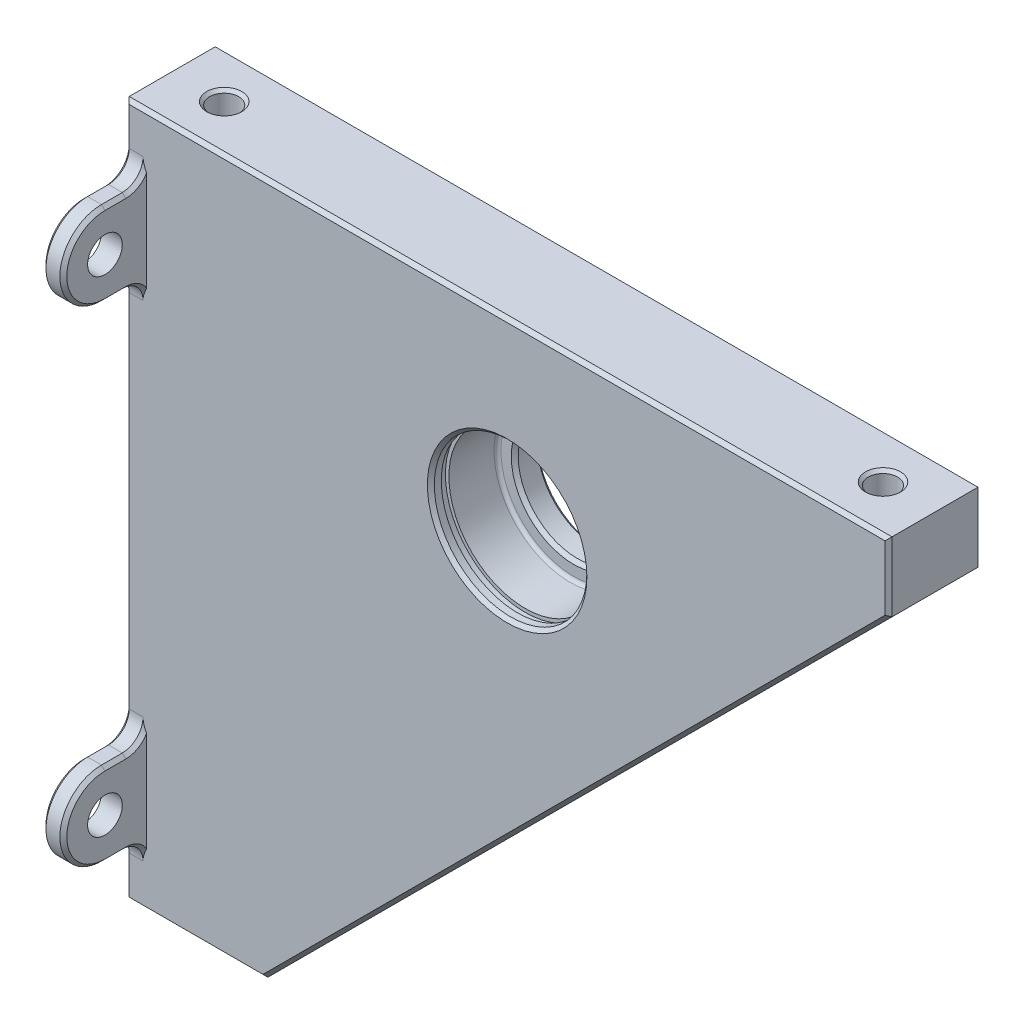
from build123d import *

# Parameters (mm, degrees)
BOSS_EXTRUDE1_DEPTH         = 13.4
BOSS_EXTRUDE2_DEPTH         = 3
FILLET1_R                   = 3
CHAMFER1_SIZE               = 0.5
F_5_0MM_DOWEL_HOLE1_D       = 5
FASE1_SIZE                  = 0.5
M5_TAPPED_HOLE1_D           = 4.2
M5_TAPPED_HOLE1_DEPTH       = 10
M5_TAPPED_HOLE1_CSINK_D     = 5.056
M5_TAPPED_HOLE1_CSINK_ANGLE = 90
M5_TAPPED_HOLE1_TIP         = 1.2618073


with BuildPart() as part:
    # Sketch1 → Boss-Extrude1 (new body)
    with BuildSketch(Plane.XY):
        Polygon((0, 0), (20, 0), (110, 90), (110, 100), (0, 100), align=None)
    extrude(amount=BOSS_EXTRUDE1_DEPTH)

    # Sketch3 → Boss-Extrude2 (add)
    with BuildSketch(Plane.ZY):
        with BuildLine():
            Line((13.4, 91), (19.4, 91))
            ThreePointArc((19.4, 91), (25.4, 85), (19.4, 79))
            Line((19.4, 79), (13.4, 79))
            Line((13.4, 79), (13.4, 91))
        make_face()
        with BuildLine():
            Line((13.4, 21), (19.4, 21))
            ThreePointArc((19.4, 21), (25.4, 15), (19.4, 9))
            Line((19.4, 9), (13.4, 9))
            Line((13.4, 9), (13.4, 21))
        make_face()
        with BuildLine():
            Line((0, 91), (-6, 91))
            ThreePointArc((-6, 91), (-12, 85), (-6, 79))
            Line((-6, 79), (0, 79))
            Line((0, 79), (0, 91))
        make_face()
        with BuildLine():
            Line((0, 21), (-6, 21))
            ThreePointArc((-6, 21), (-12, 15), (-6, 9))
            Line((-6, 9), (0, 9))
            Line((0, 9), (0, 21))
        make_face()
    extrude(amount=-BOSS_EXTRUDE2_DEPTH)

    # Fillet1
    fillet1_edges = [part.edges().sort_by_distance(p)[0] for p in [
        (1.5, 9, 13.4),
        (1.5, 21, 13.4),
        (1.5, 91, 0),
        (1.5, 79, 0),
        (1.5, 21, 0),
        (1.5, 9, 0),
        (1.5, 79, 13.4),
        (1.5, 91, 13.4),
    ]]
    fillet(fillet1_edges, radius=FILLET1_R)

    # Chamfer1
    # the kernel refuses this chamfer: 0.5 mm, written as the material it takes off along each edge
    with BuildSketch(Plane(origin=(19.09077276, -0.90922724, 13.4), x_dir=(0.01944252080601503, -0.019442520806014957, -0.9996219169112968), z_dir=(0.7071067811865462, 0.7071067811865489, 0))) as chamfer1_piece_1:
        Polygon((CHAMFER1_SIZE * 0.999621916911, CHAMFER1_SIZE * 0.0274958766106), (-CHAMFER1_SIZE * 0.0274958766106, CHAMFER1_SIZE * 0.999621916911), (0, 0), align=None)
    extrude(amount=129.850903602, mode=Mode.SUBTRACT)
    with BuildSketch(Plane(origin=(110, 88.714158506, 13.4), x_dir=(0.0274958766105822, 0, -0.999621916911297), z_dir=(0, 1, 0))) as chamfer1_piece_2:
        Polygon((CHAMFER1_SIZE * 0.999621916911, CHAMFER1_SIZE * 0.0274958766106), (-CHAMFER1_SIZE * 0.0274958766106, CHAMFER1_SIZE * 0.999621916911), (0, 0), align=None)
    extrude(amount=12.571682988, mode=Mode.SUBTRACT)
    with BuildSketch(Plane(origin=(111.285841494, 100, 13.4), x_dir=(0, 0.0274958766105822, -0.999621916911297), z_dir=(-1, 0, 0)), Plane(origin=(111.285841494, 100, 0), x_dir=(0, -0.9996219169112968, -0.027495876610586483), z_dir=(-1, 0, 0))) as chamfer1_piece_3:
        Polygon((CHAMFER1_SIZE * 0.999621916911, CHAMFER1_SIZE * 0.0274958766106), (-CHAMFER1_SIZE * 0.0274958766106, CHAMFER1_SIZE * 0.999621916911), (0, 0), align=None)
    extrude(amount=112.571682988, mode=Mode.SUBTRACT)
    with BuildSketch(Plane(origin=(3, 21, 16.4), x_dir=(0.02749587661058555, -0.9996219169112968, 1.1837901526131803e-15), z_dir=(0, 0, 1)), Plane(origin=(0, 79, -6), x_dir=(-0.027495876610586535, 0.9996219169112968, 0), z_dir=(0, 0, 1)), Plane(origin=(0, 9, -6), x_dir=(-0.027495876610586584, 0.9996219169112968, 0), z_dir=(0, 0, 1)), Plane(origin=(3, 91, 16.4), x_dir=(0.02749587661058574, -0.9996219169112968, 2.3675803052263605e-15), z_dir=(0, 0, 1)), Plane(origin=(3, 79, 19.4), x_dir=(0.027495876610586605, 0.9996219169112968, -2.3675803052263605e-15), z_dir=(0, 0, -1)), Plane(origin=(3, 9, 19.4), x_dir=(0.02749587661058651, 0.9996219169112968, -1.1837901526131803e-15), z_dir=(0, 0, -1)), Plane(origin=(0, 21, -3), x_dir=(-0.027495876610586823, -0.9996219169112968, 0), z_dir=(0, 0, -1)), Plane(origin=(0, 91, -3), x_dir=(-0.027495876610586435, -0.9996219169112968, 0), z_dir=(0, 0, -1))) as chamfer1_piece_4:
        Polygon((CHAMFER1_SIZE * 0.999621916911, -CHAMFER1_SIZE * 0.0274958766106), (-CHAMFER1_SIZE * 0.0274958766106, -CHAMFER1_SIZE * 0.999621916911), (0, 0), align=None)
    extrude(amount=3, mode=Mode.SUBTRACT)
    with BuildSketch(Plane(origin=(3, 15, 19.4), x_dir=(0, 1, 0), z_dir=(0, 0, -1))) as chamfer1_piece_5:
        Polygon((6 - CHAMFER1_SIZE, 0), (6, -CHAMFER1_SIZE), (6, 0), align=None)
    revolve(axis=Axis((3, 15, 19.4), (1, 0, 0)), revolution_arc=180, mode=Mode.SUBTRACT)
    with BuildSketch(Plane(origin=(0, 15, 19.4), x_dir=(0, 1, 0), z_dir=(0, 0, -1))) as chamfer1_piece_6:
        Polygon((6 - CHAMFER1_SIZE, 0), (6, CHAMFER1_SIZE), (6, 0), align=None)
    revolve(axis=Axis((0, 15, 19.4), (1, 0, 0)), revolution_arc=180, mode=Mode.SUBTRACT)
    with BuildSketch(Plane(origin=(0, 21, 16.4), x_dir=(-0.027495876610586823, -0.9996219169112968, 1.1837901526131803e-15), z_dir=(0, 0, 1)), Plane(origin=(3, 79, -6), x_dir=(0.027495876610586605, 0.9996219169112968, 0), z_dir=(0, 0, 1)), Plane(origin=(3, 9, -6), x_dir=(0.02749587661058651, 0.9996219169112968, 0), z_dir=(0, 0, 1)), Plane(origin=(0, 91, 16.4), x_dir=(-0.027495876610586435, -0.9996219169112968, 2.3675803052263605e-15), z_dir=(0, 0, 1)), Plane(origin=(0, 79, 19.4), x_dir=(-0.027495876610586535, 0.9996219169112968, -2.3675803052263605e-15), z_dir=(0, 0, -1)), Plane(origin=(0, 9, 19.4), x_dir=(-0.027495876610586584, 0.9996219169112968, -1.1837901526131803e-15), z_dir=(0, 0, -1)), Plane(origin=(3, 21, -3), x_dir=(0.02749587661058555, -0.9996219169112968, 0), z_dir=(0, 0, -1)), Plane(origin=(3, 91, -3), x_dir=(0.02749587661058574, -0.9996219169112968, 0), z_dir=(0, 0, -1))) as chamfer1_piece_7:
        Polygon((CHAMFER1_SIZE * 0.999621916911, CHAMFER1_SIZE * 0.0274958766106), (-CHAMFER1_SIZE * 0.0274958766106, CHAMFER1_SIZE * 0.999621916911), (0, 0), align=None)
    extrude(amount=3, mode=Mode.SUBTRACT)
    with BuildSketch(Plane(origin=(3, 85, -6), x_dir=(0, 1, 0), z_dir=(0, 0, 1))) as chamfer1_piece_8:
        Polygon((6 - CHAMFER1_SIZE, 0), (6, CHAMFER1_SIZE), (6, 0), align=None)
    revolve(axis=Axis((3, 85, -6), (-1, 0, 0)), revolution_arc=180, mode=Mode.SUBTRACT)
    with BuildSketch(Plane(origin=(0, 85, -6), x_dir=(0, 1, 0), z_dir=(0, 0, 1))) as chamfer1_piece_9:
        Polygon((6 - CHAMFER1_SIZE, 0), (6, -CHAMFER1_SIZE), (6, 0), align=None)
    revolve(axis=Axis((0, 85, -6), (-1, 0, 0)), revolution_arc=180, mode=Mode.SUBTRACT)
    with BuildSketch(Plane(origin=(3, 15, -6), x_dir=(0, 1, 0), z_dir=(0, 0, 1))) as chamfer1_piece_10:
        Polygon((6 - CHAMFER1_SIZE, 0), (6, CHAMFER1_SIZE), (6, 0), align=None)
    revolve(axis=Axis((3, 15, -6), (-1, 0, 0)), revolution_arc=180, mode=Mode.SUBTRACT)
    with BuildSketch(Plane(origin=(0, 15, -6), x_dir=(0, 1, 0), z_dir=(0, 0, 1))) as chamfer1_piece_11:
        Polygon((6 - CHAMFER1_SIZE, 0), (6, -CHAMFER1_SIZE), (6, 0), align=None)
    revolve(axis=Axis((0, 15, -6), (-1, 0, 0)), revolution_arc=180, mode=Mode.SUBTRACT)
    with BuildSketch(Plane(origin=(3, 85, 19.4), x_dir=(0, 1, 0), z_dir=(0, 0, -1))) as chamfer1_piece_12:
        Polygon((6 - CHAMFER1_SIZE, 0), (6, -CHAMFER1_SIZE), (6, 0), align=None)
    revolve(axis=Axis((3, 85, 19.4), (1, 0, 0)), revolution_arc=180, mode=Mode.SUBTRACT)
    with BuildSketch(Plane(origin=(0, 85, 19.4), x_dir=(0, 1, 0), z_dir=(0, 0, -1))) as chamfer1_piece_13:
        Polygon((6 - CHAMFER1_SIZE, 0), (6, CHAMFER1_SIZE), (6, 0), align=None)
    revolve(axis=Axis((0, 85, 19.4), (1, 0, 0)), revolution_arc=180, mode=Mode.SUBTRACT)
    with BuildSketch(Plane(origin=(0, 101.285841494, 13.4), x_dir=(-0.027495876610586337, 0, -0.9996219169112968), z_dir=(0, -1, 0)), Plane(origin=(0, 6, 13.4), x_dir=(-0.0274958766105864, 0, -0.9996219169112968), z_dir=(0, -1, 0))) as chamfer1_piece_14:
        Polygon((CHAMFER1_SIZE * 0.999621916911, CHAMFER1_SIZE * 0.0274958766106), (-CHAMFER1_SIZE * 0.0274958766106, CHAMFER1_SIZE * 0.999621916911), (0, 0), align=None)
    extrude(amount=7.285841494, mode=Mode.SUBTRACT)
    with BuildSketch(Plane(origin=(110, 88.714158506, 0), x_dir=(0.02749587661058218, 0, 0.9996219169112968), z_dir=(0, 1, 0))) as chamfer1_piece_15:
        Polygon((CHAMFER1_SIZE * 0.999621916911, -CHAMFER1_SIZE * 0.0274958766106), (-CHAMFER1_SIZE * 0.0274958766106, -CHAMFER1_SIZE * 0.999621916911), (0, 0), align=None)
    extrude(amount=12.571682988, mode=Mode.SUBTRACT)
    with BuildSketch(Plane(origin=(19.09077276, -0.90922724, 0), x_dir=(0.01944252080601502, -0.019442520806014944, 0.9996219169112968), z_dir=(0.7071067811865462, 0.7071067811865489, 0))) as chamfer1_piece_16:
        Polygon((CHAMFER1_SIZE * 0.999621916911, -CHAMFER1_SIZE * 0.0274958766106), (-CHAMFER1_SIZE * 0.0274958766106, -CHAMFER1_SIZE * 0.999621916911), (0, 0), align=None)
    extrude(amount=129.850903602, mode=Mode.SUBTRACT)
    with BuildSketch(Plane(origin=(0, 76, 13.4), x_dir=(-0.027495876610586296, 0, -0.9996219169112968), z_dir=(0, -1, 0))) as chamfer1_piece_17:
        Polygon((CHAMFER1_SIZE * 0.999621916911, CHAMFER1_SIZE * 0.0274958766106), (-CHAMFER1_SIZE * 0.0274958766106, CHAMFER1_SIZE * 0.999621916911), (0, 0), align=None)
    extrude(amount=52, mode=Mode.SUBTRACT)
    with BuildSketch(Plane(origin=(-1.285841494, 0, 0), x_dir=(0, -0.027495876610586372, 0.9996219169112968), z_dir=(1, 0, 0))) as chamfer1_piece_18:
        Polygon((CHAMFER1_SIZE * 0.999621916911, -CHAMFER1_SIZE * 0.0274958766106), (-CHAMFER1_SIZE * 0.0274958766106, -CHAMFER1_SIZE * 0.999621916911), (0, 0), align=None)
    extrude(amount=22.571682988, mode=Mode.SUBTRACT)
    with BuildSketch(Plane(origin=(0, 101.285841494, 0), x_dir=(-0.027495876610586313, 0, 0.9996219169112968), z_dir=(0, -1, 0)), Plane(origin=(0, 6, 0), x_dir=(-0.027495876610586382, 0, 0.9996219169112968), z_dir=(0, -1, 0))) as chamfer1_piece_19:
        Polygon((CHAMFER1_SIZE * 0.999621916911, -CHAMFER1_SIZE * 0.0274958766106), (-CHAMFER1_SIZE * 0.0274958766106, -CHAMFER1_SIZE * 0.999621916911), (0, 0), align=None)
    extrude(amount=7.285841494, mode=Mode.SUBTRACT)
    with BuildSketch(Plane(origin=(0, 76, 0), x_dir=(-0.027495876610586275, 0, 0.9996219169112968), z_dir=(0, -1, 0))) as chamfer1_piece_20:
        Polygon((CHAMFER1_SIZE * 0.999621916911, -CHAMFER1_SIZE * 0.0274958766106), (-CHAMFER1_SIZE * 0.0274958766106, -CHAMFER1_SIZE * 0.999621916911), (0, 0), align=None)
    extrude(amount=52, mode=Mode.SUBTRACT)
    with BuildSketch(Plane(origin=(0, 76, 16.4), x_dir=(0, 0, -1), z_dir=(0, -1, 0))) as chamfer1_piece_21:
        Polygon((3 + CHAMFER1_SIZE, 0), (3, CHAMFER1_SIZE), (3, 0), align=None)
    revolve(axis=Axis((0, 76, 16.4), (1, 0, 0)), revolution_arc=90, mode=Mode.SUBTRACT)
    with BuildSketch(Plane(origin=(3, 76, 16.4), x_dir=(0, -0.4157670192732941, -0.9094711571482629), z_dir=(0, -0.9094711571482629, 0.4157670192732941))) as chamfer1_piece_22_section:
        Polygon((3, -CHAMFER1_SIZE), (3 + CHAMFER1_SIZE, 0), (3, 0), align=None)
    chamfer1_piece_22 = revolve(axis=Axis((3, 76, 16.4), (1, 0, 0)), revolution_arc=114.56762863, mode=Mode.PRIVATE)
    chamfer1_piece_22 = split(chamfer1_piece_22, bisect_by=Plane(origin=(2.821133153, 78.122730565, 13.4), z_dir=(0, 0, 1)), keep=Keep.TOP, mode=Mode.PRIVATE)
    add(chamfer1_piece_22, mode=Mode.SUBTRACT)
    with BuildSketch(Plane(origin=(0, 94, 16.4), x_dir=(0, 0, -1), z_dir=(0, 1, 0))) as chamfer1_piece_23:
        Polygon((3 + CHAMFER1_SIZE, 0), (3, -CHAMFER1_SIZE), (3, 0), align=None)
    revolve(axis=Axis((0, 94, 16.4), (-1, 0, 0)), revolution_arc=90, mode=Mode.SUBTRACT)
    with BuildSketch(Plane(origin=(3, 94, 16.4), x_dir=(0, 0.4157670192732941, -0.9094711571482629), z_dir=(0, 0.9094711571482629, 0.4157670192732941))) as chamfer1_piece_24_section:
        Polygon((3 + CHAMFER1_SIZE, 0), (3, CHAMFER1_SIZE), (3, 0), align=None)
    chamfer1_piece_24 = revolve(axis=Axis((3, 94, 16.4), (-1, 0, 0)), revolution_arc=114.56762863, mode=Mode.PRIVATE)
    chamfer1_piece_24 = split(chamfer1_piece_24, bisect_by=Plane(origin=(2.821133146, 91.87726966, 13.4), z_dir=(0, 0, 1)), keep=Keep.TOP, mode=Mode.PRIVATE)
    add(chamfer1_piece_24, mode=Mode.SUBTRACT)
    with BuildSketch(Plane(origin=(0, 24, 16.4), x_dir=(0, 0, -1), z_dir=(0, 1, 0))) as chamfer1_piece_25:
        Polygon((3 + CHAMFER1_SIZE, 0), (3, -CHAMFER1_SIZE), (3, 0), align=None)
    revolve(axis=Axis((0, 24, 16.4), (-1, 0, 0)), revolution_arc=90, mode=Mode.SUBTRACT)
    with BuildSketch(Plane(origin=(-1.285841494, 0, 13.4), x_dir=(0, -0.02749587661058639, -0.9996219169112968), z_dir=(1, 0, 0))) as chamfer1_piece_26:
        Polygon((CHAMFER1_SIZE * 0.999621916911, CHAMFER1_SIZE * 0.0274958766106), (-CHAMFER1_SIZE * 0.0274958766106, CHAMFER1_SIZE * 0.999621916911), (0, 0), align=None)
    extrude(amount=22.571682988, mode=Mode.SUBTRACT)
    with BuildSketch(Plane(origin=(3, 24, 16.4), x_dir=(0, 0.4157670192732905, -0.9094711571482645), z_dir=(0, 0.9094711571482645, 0.4157670192732905))) as chamfer1_piece_27_section:
        Polygon((3 + CHAMFER1_SIZE, 0), (3, CHAMFER1_SIZE), (3, 0), align=None)
    chamfer1_piece_27 = revolve(axis=Axis((3, 24, 16.4), (-1, 0, 0)), revolution_arc=114.56762863, mode=Mode.PRIVATE)
    chamfer1_piece_27 = split(chamfer1_piece_27, bisect_by=Plane(origin=(2.821133146, 21.877269654, 13.4), z_dir=(0, 0, 1)), keep=Keep.TOP, mode=Mode.PRIVATE)
    add(chamfer1_piece_27, mode=Mode.SUBTRACT)
    with BuildSketch(Plane(origin=(0, 6, 16.4), x_dir=(0, 0, -1), z_dir=(0, -1, 0))) as chamfer1_piece_28:
        Polygon((3 + CHAMFER1_SIZE, 0), (3, CHAMFER1_SIZE), (3, 0), align=None)
    revolve(axis=Axis((0, 6, 16.4), (1, 0, 0)), revolution_arc=90, mode=Mode.SUBTRACT)
    with BuildSketch(Plane(origin=(3, 6, 16.4), x_dir=(0, -0.4157670192732901, -0.9094711571482649), z_dir=(0, -0.9094711571482649, 0.4157670192732901))) as chamfer1_piece_29_section:
        Polygon((3, -CHAMFER1_SIZE), (3 + CHAMFER1_SIZE, 0), (3, 0), align=None)
    chamfer1_piece_29 = revolve(axis=Axis((3, 6, 16.4), (1, 0, 0)), revolution_arc=114.56762863, mode=Mode.PRIVATE)
    chamfer1_piece_29 = split(chamfer1_piece_29, bisect_by=Plane(origin=(2.821133155, 8.122730647, 13.4), z_dir=(0, 0, 1)), keep=Keep.TOP, mode=Mode.PRIVATE)
    add(chamfer1_piece_29, mode=Mode.SUBTRACT)
    with BuildSketch(Plane(origin=(0, 24, -3), x_dir=(0, 0, 1), z_dir=(0, 1, 0))) as chamfer1_piece_30:
        Polygon((3 + CHAMFER1_SIZE, 0), (3, CHAMFER1_SIZE), (3, 0), align=None)
    revolve(axis=Axis((0, 24, -3), (1, 0, 0)), revolution_arc=90, mode=Mode.SUBTRACT)
    with BuildSketch(Plane(origin=(3, 24, -3), x_dir=(0, 0.4157670192732905, 0.9094711571482645), z_dir=(0, 0.9094711571482645, -0.4157670192732905))) as chamfer1_piece_31_section:
        Polygon((3 + CHAMFER1_SIZE, 0), (3, -CHAMFER1_SIZE), (3, 0), align=None)
    chamfer1_piece_31 = revolve(axis=Axis((3, 24, -3), (1, 0, 0)), revolution_arc=114.56762863, mode=Mode.PRIVATE)
    chamfer1_piece_31 = split(chamfer1_piece_31, bisect_by=Plane(origin=(2.821133159, 21.877269233, 0), z_dir=(0, 0, -1)), keep=Keep.TOP, mode=Mode.PRIVATE)
    add(chamfer1_piece_31, mode=Mode.SUBTRACT)
    with BuildSketch(Plane(origin=(0, 6, -3), x_dir=(0, 0, 1), z_dir=(0, -1, 0))) as chamfer1_piece_32:
        Polygon((3 + CHAMFER1_SIZE, 0), (3, -CHAMFER1_SIZE), (3, 0), align=None)
    revolve(axis=Axis((0, 6, -3), (-1, 0, 0)), revolution_arc=90, mode=Mode.SUBTRACT)
    with BuildSketch(Plane(origin=(3, 6, -3), x_dir=(0, -0.4157670192732901, 0.9094711571482649), z_dir=(0, -0.9094711571482649, -0.4157670192732901))) as chamfer1_piece_33_section:
        Polygon((3, CHAMFER1_SIZE), (3 + CHAMFER1_SIZE, 0), (3, 0), align=None)
    chamfer1_piece_33 = revolve(axis=Axis((3, 6, -3), (-1, 0, 0)), revolution_arc=114.56762863, mode=Mode.PRIVATE)
    chamfer1_piece_33 = split(chamfer1_piece_33, bisect_by=Plane(origin=(2.821133152, 8.122730538, 0), z_dir=(0, 0, -1)), keep=Keep.TOP, mode=Mode.PRIVATE)
    add(chamfer1_piece_33, mode=Mode.SUBTRACT)
    with BuildSketch(Plane(origin=(0, 94, -3), x_dir=(0, 0, 1), z_dir=(0, 1, 0))) as chamfer1_piece_34:
        Polygon((3 + CHAMFER1_SIZE, 0), (3, CHAMFER1_SIZE), (3, 0), align=None)
    revolve(axis=Axis((0, 94, -3), (1, 0, 0)), revolution_arc=90, mode=Mode.SUBTRACT)
    with BuildSketch(Plane(origin=(3, 94, -3), x_dir=(0, 0.4157670192732941, 0.9094711571482629), z_dir=(0, 0.9094711571482629, -0.4157670192732941))) as chamfer1_piece_35_section:
        Polygon((3 + CHAMFER1_SIZE, 0), (3, -CHAMFER1_SIZE), (3, 0), align=None)
    chamfer1_piece_35 = revolve(axis=Axis((3, 94, -3), (1, 0, 0)), revolution_arc=114.56762863, mode=Mode.PRIVATE)
    chamfer1_piece_35 = split(chamfer1_piece_35, bisect_by=Plane(origin=(2.821133153, 91.877269435, 0), z_dir=(0, 0, -1)), keep=Keep.TOP, mode=Mode.PRIVATE)
    add(chamfer1_piece_35, mode=Mode.SUBTRACT)
    with BuildSketch(Plane(origin=(0, 76, -3), x_dir=(0, 0, 1), z_dir=(0, -1, 0))) as chamfer1_piece_36:
        Polygon((3 + CHAMFER1_SIZE, 0), (3, -CHAMFER1_SIZE), (3, 0), align=None)
    revolve(axis=Axis((0, 76, -3), (-1, 0, 0)), revolution_arc=90, mode=Mode.SUBTRACT)
    with BuildSketch(Plane(origin=(3, 76, -3), x_dir=(0, -0.4157670192732941, 0.9094711571482629), z_dir=(0, -0.9094711571482629, -0.4157670192732941))) as chamfer1_piece_37_section:
        Polygon((3, CHAMFER1_SIZE), (3 + CHAMFER1_SIZE, 0), (3, 0), align=None)
    chamfer1_piece_37 = revolve(axis=Axis((3, 76, -3), (-1, 0, 0)), revolution_arc=114.56762863, mode=Mode.PRIVATE)
    chamfer1_piece_37 = split(chamfer1_piece_37, bisect_by=Plane(origin=(2.821133153, 78.122730565, 0), z_dir=(0, 0, -1)), keep=Keep.TOP, mode=Mode.PRIVATE)
    add(chamfer1_piece_37, mode=Mode.SUBTRACT)

    # Ø5.0mm Dowel Hole1 (through all)
    with Locations(Plane(origin=(3, 0, 0), x_dir=(0, 0, -1), z_dir=(1, 0, 0))):
        with Locations((-19.4, 85), (-19.4, 15), (6, 15), (6, 85)):
            Hole(F_5_0MM_DOWEL_HOLE1_D / 2)

    # Sketch7 → Cut-Revolve1 (revolve, cut)
    with BuildSketch(Plane(origin=(55, 0, 0), x_dir=(0, 0, -1), z_dir=(1, 0, 0)), mode=Mode.PRIVATE) as cut_revolve1_sk:
        with BuildLine():
            Line((-13.4, 84.5), (-11.9, 84.5))
            Line((-11.9, 84.5), (-11.9, 85))
            Line((-11.9, 85), (-10.8, 85))
            Line((-10.8, 85), (-10.8, 84.5))
            Line((-10.8, 84.5), (-4.3, 84.5))
            ThreePointArc((-4.3, 84.5), (-3.946446609, 84.353553391), (-3.8, 84))
            Line((-3.8, 84), (-3.8, 82))
            Line((-3.8, 82), (0, 82))
            Line((0, 82), (0, 73.5))
            Line((0, 73.5), (-13.4, 73.5))
            Line((-13.4, 73.5), (-13.4, 84.5))
        make_face()
    revolve(cut_revolve1_sk.sketch.rotate(Axis((55, 73.5, 13.4), (0, 0, -1)), 90), axis=Axis((55, 73.5, 13.4), (0, 0, -1)), mode=Mode.SUBTRACT)

    # Fase1
    fase1_edges = [part.edges().sort_by_distance(p)[0] for p in [
        (44, 73.5, 13.4),
        (46.5, 73.5, 3.8),
        (46.5, 73.5, 0),
    ]]
    chamfer(fase1_edges, length=FASE1_SIZE)

    # M5 Tapped Hole1
    with Locations(Plane(origin=(0, 100, 0), x_dir=(1, 0, 0), z_dir=(0, 1, 0))):
        with Locations((7.5, -6.7), (102.5, -6.7)):
            CounterSinkHole(M5_TAPPED_HOLE1_D / 2, M5_TAPPED_HOLE1_CSINK_D / 2, depth=M5_TAPPED_HOLE1_DEPTH, counter_sink_angle=M5_TAPPED_HOLE1_CSINK_ANGLE)
            with Locations((0, 0, -(M5_TAPPED_HOLE1_DEPTH + M5_TAPPED_HOLE1_TIP / 2))):  # 118° drill point
                Cone(0, M5_TAPPED_HOLE1_D / 2, M5_TAPPED_HOLE1_TIP, mode=Mode.SUBTRACT)


solid = part.part
